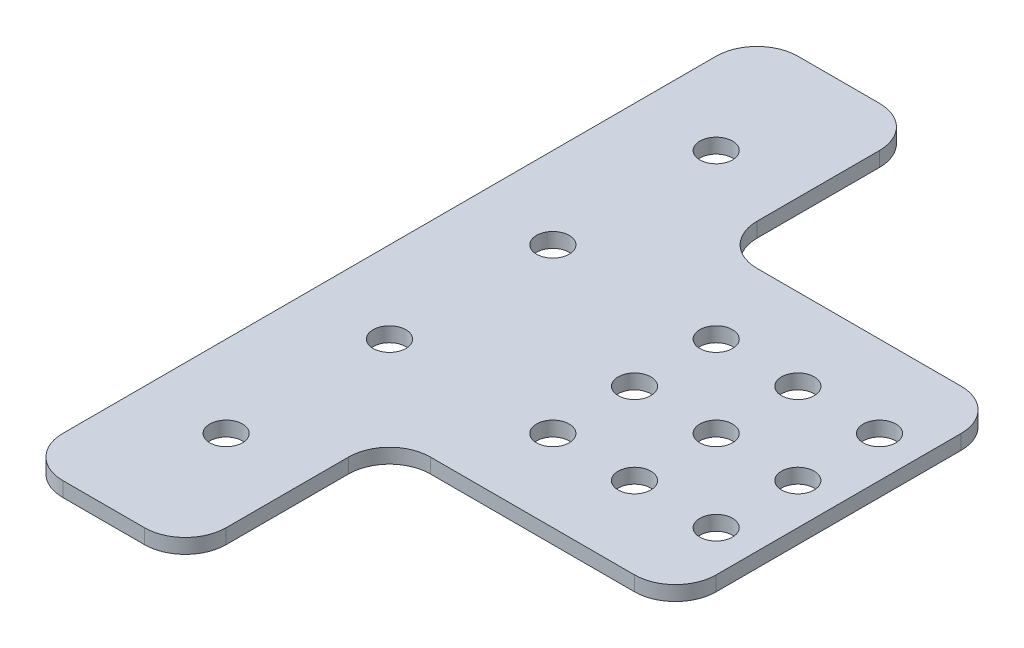
from build123d import *

# Parameters (mm, degrees)
SKETCH1_R           = 2.54
BOSS_EXTRUDE1_DEPTH = 2.286
FILLET1_R           = 6.35


with BuildPart() as part:
    # Sketch1 → Boss-Extrude1 (new body)
    with BuildSketch(Plane(origin=(0, 0, 0), x_dir=(1, 0, 0), z_dir=(0, 1, 0))):
        Polygon((25.4, 114.3), (0, 114.3), (0, 0), (25.4, 0), (25.4, 31.75), (69.85, 31.75), (69.85, 82.55), (25.4, 82.55), align=None)
        with Locations((12.7, 95.25)):
            Circle(SKETCH1_R, mode=Mode.SUBTRACT)
        with Locations((12.7, 69.85)):
            Circle(SKETCH1_R, mode=Mode.SUBTRACT)
        with Locations((12.7, 44.45)):
            Circle(SKETCH1_R, mode=Mode.SUBTRACT)
        with Locations((12.7, 19.05)):
            Circle(SKETCH1_R, mode=Mode.SUBTRACT)
        with Locations((38.1, 69.85)):
            Circle(SKETCH1_R, mode=Mode.SUBTRACT)
        with Locations((50.8, 69.85)):
            Circle(SKETCH1_R, mode=Mode.SUBTRACT)
        with Locations((63.5, 69.85)):
            Circle(SKETCH1_R, mode=Mode.SUBTRACT)
        with Locations((50.8, 57.15)):
            Circle(SKETCH1_R, mode=Mode.SUBTRACT)
        with Locations((63.5, 57.15)):
            Circle(SKETCH1_R, mode=Mode.SUBTRACT)
        with Locations((50.8, 44.45)):
            Circle(SKETCH1_R, mode=Mode.SUBTRACT)
        with Locations((63.5, 44.45)):
            Circle(SKETCH1_R, mode=Mode.SUBTRACT)
        with Locations((38.1, 57.15)):
            Circle(SKETCH1_R, mode=Mode.SUBTRACT)
        with Locations((38.1, 44.45)):
            Circle(SKETCH1_R, mode=Mode.SUBTRACT)
    extrude(amount=BOSS_EXTRUDE1_DEPTH)

    # Fillet1
    fillet1_edges = [part.edges().sort_by_distance(p)[0] for p in [
        (25.4, 1.143, -82.55),
        (69.85, 1.143, -82.55),
        (69.85, 1.143, -31.75),
        (25.4, 1.143, -31.75),
        (25.4, 1.143, 0),
        (0, 1.143, -114.3),
        (25.4, 1.143, -114.3),
        (0, 1.143, 0),
    ]]
    fillet(fillet1_edges, radius=FILLET1_R)


solid = part.part
